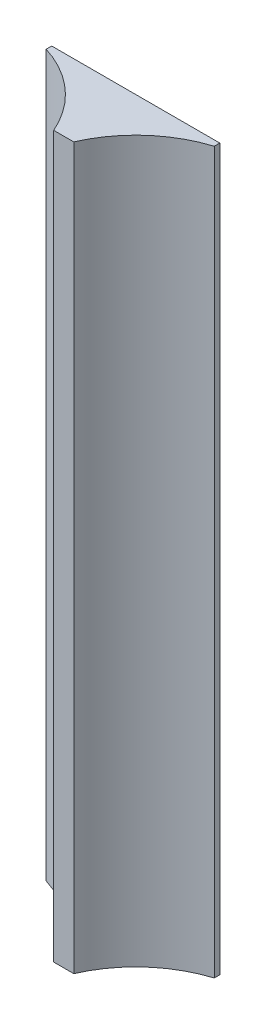
from build123d import *

# Parameters (mm, degrees)
BOSS_EXTRUDE1_DEPTH = 60


with BuildPart() as part:
    # Sketch1 → Boss-Extrude1 (new body)
    with BuildSketch(Plane(origin=(0, 0, 0), x_dir=(1, 0, 0), z_dir=(0, 1, 0))):
        with BuildLine():
            Line((-0.83484861, 0), (0.83484861, 0))
            ThreePointArc((0.83484861, 0), (3.316517146, 3.438484855), (7, 5.539392014))
            Line((7, 5.539392014), (7, 6))
            Line((7, 6), (-7, 6))
            Line((-7, 6), (-7, 5.539392014))
            ThreePointArc((-7, 5.539392014), (-3.316517146, 3.438484855), (-0.83484861, 0))
        make_face()
    extrude(amount=BOSS_EXTRUDE1_DEPTH)


solid = part.part
